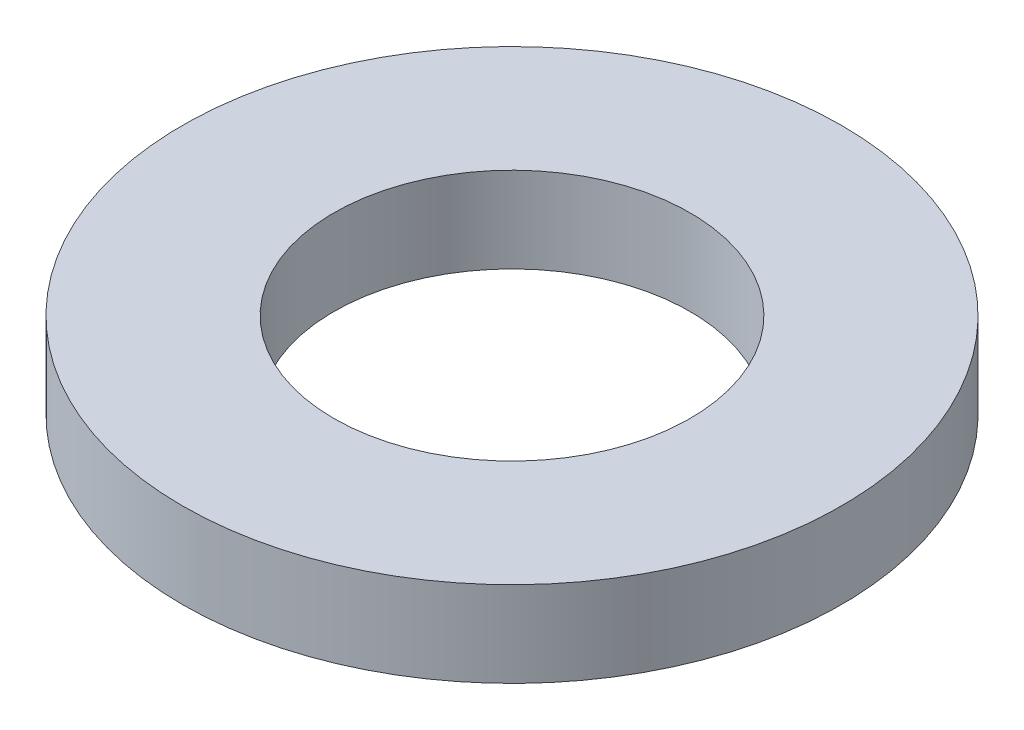
from build123d import *

# Parameters (mm, degrees)
SKETCH1_R           = 92.5
BOSS_EXTRUDE1_DEPTH = 24
SKETCH2_R           = 50
CUT_EXTRUDE1_DEPTH  = 133.998120287


with BuildPart() as part:
    # Sketch1 → Boss-Extrude1 (new body)
    with BuildSketch(Plane(origin=(0, 0, 0), x_dir=(1, 0, 0), z_dir=(0, 1, 0))):
        Circle(SKETCH1_R)
    extrude(amount=BOSS_EXTRUDE1_DEPTH)

    # Sketch2 → Cut-Extrude1 (cut, through all)
    with BuildSketch(Plane(origin=(0, 0, 0), x_dir=(1, 0, 0), z_dir=(0, 1, 0))):
        Circle(SKETCH2_R)
    extrude(amount=CUT_EXTRUDE1_DEPTH, mode=Mode.SUBTRACT)


solid = part.part
